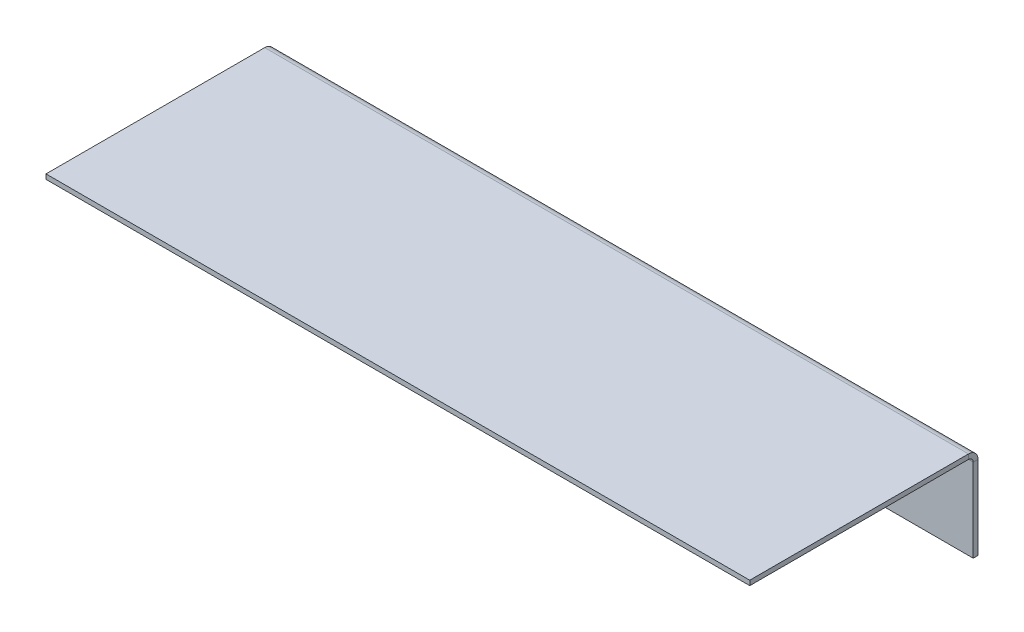
from build123d import *

# Parameters (mm, degrees)
BASE_FLANGE1_DEPTH = 469.9
SKETCH10_W         = 152.4
SKETCH10_H         = 61.9125
CUT_EXTRUDE5_DEPTH = 510.278313523


# Sheet-metal steps are written as plain solids
with BuildPart() as part:
    # Sketch1 → Base-Flange1 (new body)
    with BuildSketch(Plane(origin=(0, 0, 0), x_dir=(0, 0, -1), z_dir=(1, 0, 0))):
        with BuildLine():
            Line((0, 0), (146.05, 0))
            ThreePointArc((146.05, 0), (150.540128061, 1.859871939), (152.4, 6.35))
            Line((152.4, 6.35), (152.4, 117.475))
            ThreePointArc((152.4, 117.475), (150.540128061, 121.965128061), (146.05, 123.825))
            Line((146.05, 123.825), (0, 123.825))
            Line((0, 123.825), (0, 120.65))
            Line((0, 120.65), (146.05, 120.65))
            ThreePointArc((146.05, 120.65), (148.29506403, 119.72006403), (149.225, 117.475))
            Line((149.225, 117.475), (149.225, 6.35))
            ThreePointArc((149.225, 6.35), (148.29506403, 4.10493597), (146.05, 3.175))
            Line((146.05, 3.175), (0, 3.175))
            Line((0, 3.175), (0, 0))
        make_face()
    extrude(amount=BASE_FLANGE1_DEPTH)

    # Sketch10 → Cut-Extrude5 (cut, through all)
    with BuildSketch(Plane(origin=(469.9, 0, 0), x_dir=(0, 0, -1), z_dir=(1, 0, 0))):
        with Locations((76.2, 30.95625)):
            Rectangle(SKETCH10_W, SKETCH10_H)
    extrude(amount=-CUT_EXTRUDE5_DEPTH, mode=Mode.SUBTRACT)


solid = part.part
